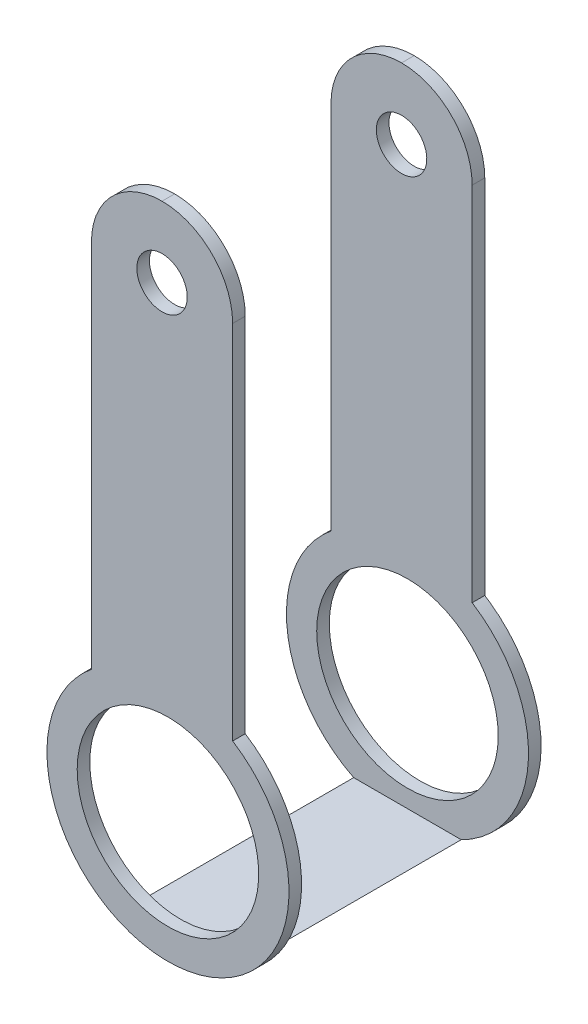
from build123d import *

# Parameters (mm, degrees)
ESBO_O1_W                  = 28
ESBO_O1_H                  = 130
RESSALTO_EXTRUS_O1_DEPTH   = 50
RESSALTO_EXTRUS_O2_START   = -50
ESBO_O2_R                  = 24
RESSALTO_EXTRUS_O2_DEPTH   = 50.000012
CORTE_EXTRUS_O2_DEPTH      = 86.782476988
CORTE_EXTRUS_O2_DEPTH_BACK = 86.782476988
ESBO_O6_W                  = 50
ESBO_O6_H                  = 3.715924279
CORTE_EXTRUS_O6_DEPTH      = 0.1
FILETE1_R                  = 14
CORTE_EXTRUS_O7_DEPTH      = 91.881514017
CORTE_EXTRUS_O8_DEPTH      = 91.881514017
ESBO_O12_R                 = 5
CORTE_EXTRUS_O10_DEPTH     = 86.782469994
ESBO_O13_R                 = 18
CORTE_EXTRUS_O11_DEPTH     = 86.782476988


with BuildPart() as part:
    # Esboço1 → Ressalto-extrusão1 (new body)
    with BuildSketch(Plane.XY):
        Rectangle(ESBO_O1_W, ESBO_O1_H)
    extrude(amount=RESSALTO_EXTRUS_O1_DEPTH)

    # Esboço2 → Ressalto-extrusão2 (add)
    with BuildSketch(Plane(origin=(0, 0, 0), x_dir=(-1, 0, 0), z_dir=(0, 0, -1)).offset(RESSALTO_EXTRUS_O2_START)):
        with Locations((-1.172051133, -41)):
            Circle(ESBO_O2_R)
    extrude(amount=RESSALTO_EXTRUS_O2_DEPTH)

    # Esboço5 → Corte-extrusão2 (cut, two sides: drawn at the far end of the back side and taken through both)
    with BuildSketch(Plane(origin=(0, 0, -1.2e-05), x_dir=(-1, 0, 0), z_dir=(0, 0, -1)).offset(-CORTE_EXTRUS_O2_DEPTH_BACK)):
        with BuildLine():
            ThreePointArc((-1.172051133, -65), (-7.844009292, -64.053957889), (-13.989971335, -61.290414528))
            Line((-13.989971335, -61.290414528), (-14, -65))
            Line((-14, -65), (-1.172051133, -65))
        make_face()
        with BuildLine():
            ThreePointArc((14, -59.595936771), (6.880821568, -63.608654123), (-1.172051133, -65))
            Line((-1.172051133, -65), (14, -65))
            Line((14, -65), (14, -59.595936771))
        make_face()
    extrude(amount=CORTE_EXTRUS_O2_DEPTH + CORTE_EXTRUS_O2_DEPTH_BACK, mode=Mode.SUBTRACT)

    # Esboço6 → Corte-extrusão6 (cut)
    with BuildSketch(Plane(origin=(14, 0, 0), x_dir=(0, 0, -1), z_dir=(1, 0, 0))):
        with Locations((-25, -63.14203786)):
            Rectangle(ESBO_O6_W, ESBO_O6_H)
    extrude(amount=-CORTE_EXTRUS_O6_DEPTH, mode=Mode.SUBTRACT)

    # Filete1
    filete1_edges = [part.edges().sort_by_distance(p)[0] for p in [
        (14, 65, 25),
        (-14, 65, 25),
    ]]
    fillet(filete1_edges, radius=FILETE1_R - 0.0001)  # a hair under: the kernel refuses the full size

    # Esboço8 → Corte-extrusão7 (cut, through all)
    with BuildSketch(Plane.ZY.offset(14)):
        Polygon((47.5, -22.404063229), (2.499991932, -22.404063229), (2.499988231, -62.5), (47.5, -62.5), align=None)
        Polygon((2.499998708, 51), (2.499991932, -22.404063229), (47.5, -22.404063229), (47.5, 51), align=None)
        Polygon((2.5, 64.999999769), (2.499998708, 51), (47.5, 51), (47.5, 65), align=None)
    extrude(amount=-CORTE_EXTRUS_O7_DEPTH, mode=Mode.SUBTRACT)

    # Esboço9 → Corte-extrusão8 (cut, through all)
    with BuildSketch(Plane(origin=(-14, 0, 0), x_dir=(0, 0, -1), z_dir=(1, 0, 0))):
        Polygon((-2.499991932, -22.404063229), (-2.499988499, -59.595936771), (-47.5, -59.595936771), (-47.5, -22.404063229), align=None)
    extrude(amount=-CORTE_EXTRUS_O8_DEPTH, mode=Mode.SUBTRACT)

    # Esboço12 → Corte-extrusão10 (cut, through all)
    with BuildSketch(Plane(origin=(0, 0, 0), x_dir=(-1, 0, 0), z_dir=(0, 0, -1))):
        with Locations((0, 51)):
            Circle(ESBO_O12_R)
    extrude(amount=-CORTE_EXTRUS_O10_DEPTH, mode=Mode.SUBTRACT)

    # Esboço13 → Corte-extrusão11 (cut, through all)
    with BuildSketch(Plane(origin=(0, 0, -1.2e-05), x_dir=(-1, 0, 0), z_dir=(0, 0, -1))):
        with Locations((-1.172051133, -41)):
            Circle(ESBO_O13_R)
    extrude(amount=-CORTE_EXTRUS_O11_DEPTH, mode=Mode.SUBTRACT)


solid = part.part
